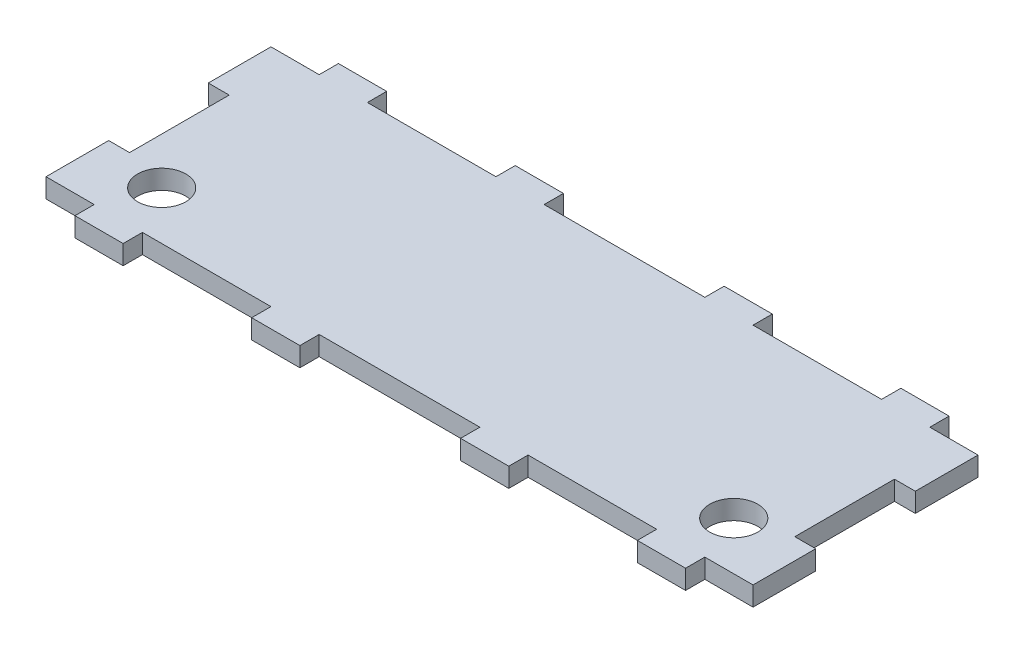
from build123d import *

# Parameters (mm, degrees)
BOSS_EXTRUDE1_DEPTH = 6
CAVITY1_START       = -365.386748432
CAVITY1_OUTLINE_W   = 6
CAVITY1_OUTLINE_H   = 30
CAVITY1_DEPTH       = 6
CAVITY1_START_2     = -151.386748432
CAVITY1_2_OUTLINE_W = 6
CAVITY1_2_OUTLINE_H = 30
CAVITY1_2_DEPTH     = 6
SKETCH2_R           = 7.5
CUT_EXTRUDE1_DEPTH  = 10
SKETCH3_W           = 6.5
SKETCH3_H           = 31
CUT_EXTRUDE2_DEPTH  = 10


# Read off the part's stored shape, not the designer's step: Cavity1
with BuildPart() as part:
    # Sketch1 → Boss-Extrude1 (new body)
    with BuildSketch(Plane(origin=(0, 0, 0), x_dir=(1, 0, 0), z_dir=(0, 1, 0))):
        Polygon((-160.386748432, 70), (-145.386748432, 70), (-145.386748432, 0), (-160.386748432, 0), (-160.386748432, -6), (-175.386748432, -6), (-175.386748432, 0), (-215.386748432, 0), (-215.386748432, -6), (-230.386748432, -6), (-230.386748432, 0), (-280.386748432, 0), (-280.386748432, -6), (-295.386748432, -6), (-295.386748432, 0), (-335.386748432, 0), (-335.386748432, -6), (-350.386748432, -6), (-350.386748432, 0), (-365.386748432, 0), (-365.386748432, 70), (-350.386748432, 70), (-350.386748432, 76), (-335.386748432, 76), (-335.386748432, 70), (-295.386748432, 70), (-295.386748432, 76), (-280.386748432, 76), (-280.386748432, 70), (-230.386748432, 70), (-230.386748432, 76), (-215.386748432, 76), (-215.386748432, 70), (-175.386748432, 70), (-175.386748432, 76), (-160.386748432, 76), align=None)
    extrude(amount=BOSS_EXTRUDE1_DEPTH)

    # Cavity1 outline → Cavity1 (cut)
    with BuildSketch(Plane.YZ.offset(CAVITY1_START)):
        with Locations((3, -35)):
            Rectangle(CAVITY1_OUTLINE_W, CAVITY1_OUTLINE_H)
    extrude(amount=CAVITY1_DEPTH, mode=Mode.SUBTRACT)

    # Cavity1 2 outline → Cavity1 2 (cut)
    with BuildSketch(Plane.YZ.offset(CAVITY1_START_2)):
        with Locations((3, -35)):
            Rectangle(CAVITY1_2_OUTLINE_W, CAVITY1_2_OUTLINE_H)
    extrude(amount=CAVITY1_2_DEPTH, mode=Mode.SUBTRACT)

    # Sketch2 → Cut-Extrude1 (cut)
    with BuildSketch(Plane.XZ):
        with Locations(Location((-166.386748432, -15, 0), (0, 0, 270))):
            Circle(SKETCH2_R)
        with Locations(Location((-344.386748432, -15, 0), (0, 0, 270))):
            Circle(SKETCH2_R)
    extrude(amount=-CUT_EXTRUDE1_DEPTH, mode=Mode.SUBTRACT)

    # Sketch3 → Cut-Extrude2 (cut)
    with BuildSketch(Plane(origin=(0, 6, 0), x_dir=(1, 0, 0), z_dir=(0, 1, 0))):
        with Locations((-148.636748432, 35)):
            Rectangle(SKETCH3_W, SKETCH3_H)
        with Locations((-362.136748432, 35)):
            Rectangle(SKETCH3_W, SKETCH3_H)
    extrude(amount=-CUT_EXTRUDE2_DEPTH, mode=Mode.SUBTRACT)


solid = part.part
